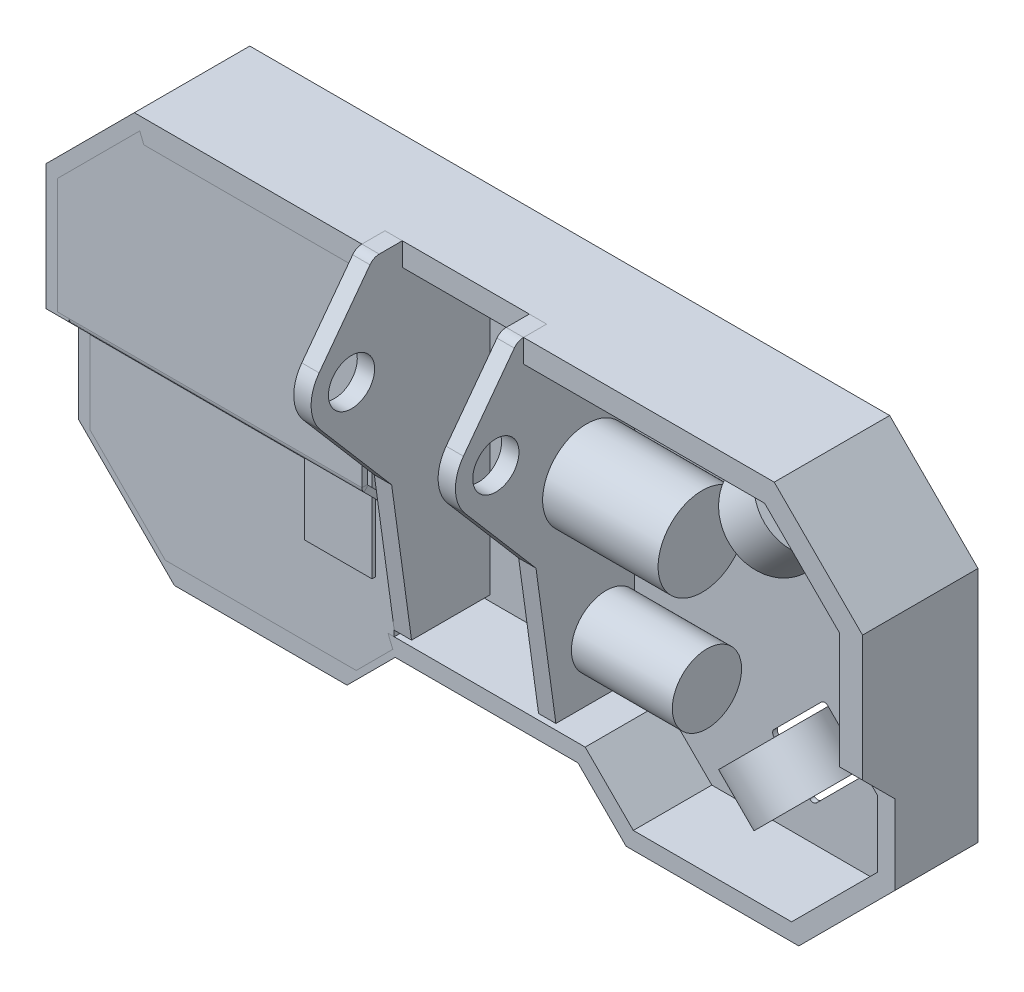
from build123d import *

# Parameters (mm, degrees)
TEMP_START              = 2.54
TEMP_BATTERY_OUTLINE_W  = 37
TEMP_BATTERY_OUTLINE_H  = 140
TEMP_BATTERY_DEPTH      = 45
TEMP_START_2            = 45.72
SIDEVIEW_SKETCH_R       = 19.05
TEMP_ARM_MOTOR_DEPTH    = 55.488642
TEMP_START_3            = 38.1
SKETCH9_3_R             = 24.264839711
TEMP_DISK_MOTOR_DEPTH   = 63.5
SKETCH2_R               = 25
TEMP_FRONT_WHEEL_DEPTH  = 27.5
SKETCH3_R               = 25
TEMP_BACK_WHEEL_DEPTH   = 27.5
BOSS_EXTRUDE14_DEPTH    = 63.5
CUT_EXTRUDE1_DEPTH      = 504.761656475
SKETCH13_W              = 88.9
SKETCH13_H              = 12.7
CUT_EXTRUDE2_DEPTH      = 12.7
CUT_EXTRUDE4_DEPTH      = 319.327625669
BILLET_BOTTOM_DEPTH     = 2.54
CUT_EXTRUDE3_DEPTH      = 321.186776216
CUT_EXTRUDE3_DEPTH_BACK = 321.186776216
L_START                 = -41.275
SKETCH8_R               = 12.7
L_UPRIGHT_DEPTH         = 9.525
R_START                 = 28.575
SKETCH8_5_R             = 12.7
R_UPRIGHT_DEPTH         = 9.525
FILLET1_R               = 2.54
BASE_FLANGE2_DEPTH      = 3.175
EDGE_FLANGE3_START      = -218.191187662
EDGE_FLANGE3_DEPTH      = 167.391187662
EDGE_FLANGE3_2_DEPTH    = 167.391187662
EDGE_FLANGE4_START      = -218.191187662
EDGE_FLANGE4_DEPTH      = 167.391187662
EDGE_FLANGE4_2_DEPTH    = 167.391187662
CUT_EXTRUDE5_DEPTH      = 319.652368089


# Read off the part's stored shape, not the designer's step: Temp Battery, Edge-Flange3, Edge-Flange4
# Sheet-metal steps are written as plain solids
with BuildPart() as part:
    # Temp Battery outline → Temp Battery (new body)
    with BuildSketch(Plane.XY.offset(TEMP_START)):
        with Locations((-79.704052147, -89.933835326)):
            Rectangle(TEMP_BATTERY_OUTLINE_W, TEMP_BATTERY_OUTLINE_H)
    extrude(amount=TEMP_BATTERY_DEPTH)


with BuildPart() as body_2:
    # Sideview Sketch → Temp Arm Motor (new body)
    with BuildSketch(Plane(origin=(0, 0, 0), x_dir=(0, 0, -1), z_dir=(1, 0, 0)).offset(TEMP_START_2)):
        with Locations((-25.749228435, -141.973618126)):
            Circle(SIDEVIEW_SKETCH_R)
    extrude(amount=TEMP_ARM_MOTOR_DEPTH)


with BuildPart() as body_3:
    # Sketch9<3> → Temp Disk Motor (new body)
    with BuildSketch(Plane(origin=(0, 0, 0), x_dir=(0, 0, -1), z_dir=(1, 0, 0)).offset(TEMP_START_3)):
        with Locations((-28.735809635, -70.080189422)):
            Circle(SKETCH9_3_R)
    extrude(amount=TEMP_DISK_MOTOR_DEPTH)


with BuildPart() as body_4:
    # Sketch2 → Temp Front Wheel (new body)
    with BuildSketch(Plane(origin=(-59.46385062, 59.46385062, 0), x_dir=(0, 0, 1), z_dir=(0.707106781186475, -0.7071067811866201, 0))):
        with Locations(Location((17.38, 127.05509626, 0), (0, 0, 270))):
            Circle(SKETCH2_R)
    extrude(amount=TEMP_FRONT_WHEEL_DEPTH)


with BuildPart() as body_5:
    # Sketch3 → Temp Back Wheel (new body)
    with BuildSketch(Plane(origin=(-161.889626162, -161.889626162, 0), x_dir=(0, 0, -1), z_dir=(0.7071067811866171, 0.7071067811864781, 0))):
        with Locations(Location((-17.38, -17.796824648, 0), (0, 0, 90))):
            Circle(SKETCH3_R)
    extrude(amount=TEMP_BACK_WHEEL_DEPTH)


with BuildPart() as body_6:
    # Mirror3: mirrored copy
    add(body_4.part.mirror(Plane(origin=(0, 0, 0), x_dir=(0, 0, 1), z_dir=(1, 0, 0))))


with BuildPart() as body_7:
    # Mirror3 2: mirrored copy
    add(body_5.part.mirror(Plane(origin=(0, 0, 0), x_dir=(0, 0, 1), z_dir=(1, 0, 0))))


with BuildPart() as body_8:
    # Sketch11 → Boss-Extrude14 (new body)
    with BuildSketch(Plane.XY):
        Polygon((-224.541187662, -166.408288725), (-171.704005038, -219.245471349), (-76.740625367, -219.245471349), (-50.275950129, -192.780796112), (50.275950129, -192.780796112), (76.740625367, -219.245471349), (171.704005038, -219.245471349), (224.541187662, -166.408288725), (224.541187662, -35.871479098), (175.969708564, 12.7), (-175.969708564, 12.7), (-224.541187662, -35.871479098), align=None)
        Polygon((-170.709196322, 0), (170.709196322, 0), (211.841187662, -41.13199134), (211.841187662, -161.147776483), (166.443492796, -206.545471349), (82.001137609, -206.545471349), (55.536462372, -180.080796112), (-55.536462372, -180.080796112), (-82.001137609, -206.545471349), (-166.443492796, -206.545471349), (-211.841187662, -161.147776483), (-211.841187662, -41.13199134), align=None, mode=Mode.SUBTRACT)
    extrude(amount=BOSS_EXTRUDE14_DEPTH)

    # Sketch12 → Cut-Extrude1 (cut, through all)
    with BuildSketch(Plane(origin=(-224.541187662, 0, 0), x_dir=(0, 0, -1), z_dir=(1, 0, 0))):
        Polygon((-63.5, -104.945471349), (-45.72, -122.725471349), (-45.72, -219.245471349), (-63.5, -219.245471349), align=None)
    extrude(amount=CUT_EXTRUDE1_DEPTH, mode=Mode.SUBTRACT)

    # Sketch13 → Cut-Extrude2 (cut)
    with BuildSketch(Plane(origin=(0, 12.7, 0), x_dir=(-1, 0, 0), z_dir=(0, -1, 0))):
        with Locations((6.35, -57.15)):
            Rectangle(SKETCH13_W, SKETCH13_H)
    extrude(amount=CUT_EXTRUDE2_DEPTH, mode=Mode.SUBTRACT)

    # Sketch31 → Cut-Extrude4 (cut, through all)
    with BuildSketch(Plane.XY.offset(45.72)):
        Polygon((-211.841187662, -122.725471349), (-215.016187662, -125.900471349), (-215.016187662, -162.462904543), (-167.758620856, -209.720471349), (-80.686009548, -209.720471349), (-54.221334311, -183.255796112), (0, -183.255796112), (54.221334311, -183.255796112), (80.686009548, -209.720471349), (167.758620856, -209.720471349), (215.016187662, -162.462904543), (215.016187662, -125.900471349), (211.841187662, -122.725471349), (211.841187662, -161.147776483), (166.443492796, -206.545471349), (82.001137609, -206.545471349), (55.536462372, -180.080796112), (0, -180.080796112), (-55.536462372, -180.080796112), (-82.001137609, -206.545471349), (-166.443492796, -206.545471349), (-211.841187662, -161.147776483), align=None)
    extrude(amount=-CUT_EXTRUDE4_DEPTH, mode=Mode.SUBTRACT)

    # Sketch14 → Billet Bottom (add)
    with BuildSketch(Plane(origin=(0, 0, 0), x_dir=(-1, 0, 0), z_dir=(0, 0, -1))):
        Polygon((224.541187662, -166.408288725), (224.541187662, -35.871479098), (175.969708564, 12.7), (-175.969708564, 12.7), (-224.541187662, -35.871479098), (-224.541187662, -166.408288725), (-171.704005038, -219.245471349), (-76.740625367, -219.245471349), (-50.275950129, -192.780796112), (50.275950129, -192.780796112), (76.740625367, -219.245471349), (171.704005038, -219.245471349), align=None)
    extrude(amount=-BILLET_BOTTOM_DEPTH)

    # Sketch15 → Cut-Extrude3 (cut, two sides: drawn at the far end of the back side and taken through both)
    with BuildSketch(Plane(origin=(0, 0, 0), x_dir=(-1, 0, 0), z_dir=(0, 0, -1)).offset(-CUT_EXTRUDE3_DEPTH_BACK)):
        Polygon((-136.439562886, -13.608632214), (-166.074408085, -43.243477413), (-142.72574217, -66.592143328), (-113.090896971, -36.957298129), align=None)
        Polygon((-166.074408085, -161.608073671), (-136.439562886, -191.24291887), (-113.090896971, -167.894252955), (-142.72574217, -138.259407756), align=None)
        Polygon((136.439562886, -13.608632214), (166.074408085, -43.243477413), (142.72574217, -66.592143328), (113.090896971, -36.957298129), align=None)
        Polygon((166.074408085, -161.608073671), (136.439562886, -191.24291887), (113.090896971, -167.894252955), (142.72574217, -138.259407756), align=None)
    extrude(amount=CUT_EXTRUDE3_DEPTH + CUT_EXTRUDE3_DEPTH_BACK, mode=Mode.SUBTRACT)

    # Fillet1
    fillet1_edges = [body_8.edges().sort_by_distance(p)[0] for p in [
        (113.090896971, -167.894252955, 1.27),
        (136.439562886, -191.24291887, 1.27),
        (166.074408085, -161.608073671, 1.27),
        (142.72574217, -138.259407756, 1.27),
        (-166.074408085, -43.243477413, 1.27),
        (-142.72574217, -66.592143328, 1.27),
        (-113.090896971, -36.957298129, 1.27),
        (-136.439562886, -13.608632214, 1.27),
        (-136.439562886, -191.24291887, 1.27),
        (-113.090896971, -167.894252955, 1.27),
        (-142.72574217, -138.259407756, 1.27),
        (-166.074408085, -161.608073671, 1.27),
        (142.72574217, -66.592143328, 1.27),
        (166.074408085, -43.243477413, 1.27),
        (136.439562886, -13.608632214, 1.27),
        (113.090896971, -36.957298129, 1.27),
    ]]
    fillet(fillet1_edges, radius=FILLET1_R)


with BuildPart() as body_9:
    # Sketch8 → L Upright (new body)
    with BuildSketch(Plane(origin=(0, 0, 0), x_dir=(0, 0, -1), z_dir=(1, 0, 0)).offset(L_START)):
        with BuildLine():
            Line((-50.8, 0), (-50.8, 12.7))
            Line((-50.8, 12.7), (-63.5, 12.7))
            ThreePointArc((-63.5, 12.7), (-66.347516998, 12.025750783), (-68.59032971, 10.146188014))
            Line((-68.59032971, 10.146188014), (-96.556153987, -27.35334195))
            ThreePointArc((-96.556153987, -27.35334195), (-100.952472396, -41.38612001), (-95.624400091, -55.092254445))
            Line((-95.624400091, -55.092254445), (-56.662044199, -100.611519823))
            Line((-56.662044199, -100.611519823), (-45.72, -180.080796112))
            Line((-45.72, -180.080796112), (-2.54, -180.080796112))
            Line((-2.54, -180.080796112), (-2.54, 0))
            Line((-2.54, 0), (-50.8, 0))
        make_face()
        with Locations((-78.74, -40.64)):
            Circle(SKETCH8_R, mode=Mode.SUBTRACT)
    extrude(amount=-L_UPRIGHT_DEPTH)


with BuildPart() as body_10:
    # Sketch8<5> → R Upright (new body)
    with BuildSketch(Plane(origin=(0, 0, 0), x_dir=(0, 0, -1), z_dir=(1, 0, 0)).offset(R_START)):
        with BuildLine():
            Line((-50.8, 0), (-50.8, 12.7))
            Line((-50.8, 12.7), (-63.5, 12.7))
            ThreePointArc((-63.5, 12.7), (-66.347516998, 12.025750783), (-68.59032971, 10.146188014))
            Line((-68.59032971, 10.146188014), (-96.556153987, -27.35334195))
            ThreePointArc((-96.556153987, -27.35334195), (-100.952472396, -41.38612001), (-95.624400091, -55.092254445))
            Line((-95.624400091, -55.092254445), (-56.662044199, -100.611519823))
            Line((-56.662044199, -100.611519823), (-45.72, -180.080796112))
            Line((-45.72, -180.080796112), (-2.54, -180.080796112))
            Line((-2.54, -180.080796112), (-2.54, 0))
            Line((-2.54, 0), (-50.8, 0))
        make_face()
        with Locations((-78.74, -40.64)):
            Circle(SKETCH8_5_R, mode=Mode.SUBTRACT)
    extrude(amount=R_UPRIGHT_DEPTH)


with BuildPart() as body_11:
    # Sketch17 → Base-Flange2 (new body)
    with BuildSketch(Plane.XY.offset(63.5)):
        Polygon((-218.191187662, -104.945471349), (-50.8, -104.945471349), (-50.8, 6.35), (-172.141337216, 6.35), (-218.191187662, -39.699850446), align=None)
    extrude(amount=-BASE_FLANGE2_DEPTH)

    # Edge-Flange3 outline → Edge-Flange3 (cut)
    with BuildSketch(Plane.YZ.offset(EDGE_FLANGE3_START)):
        with BuildLine():
            Line((-104.945471349, 63.5), (-104.945471349, 63.148658997))
            ThreePointArc((-104.945471349, 63.148658997), (-104.15418034, 63.411155789), (-103.325233579, 63.5))
            Line((-103.325233579, 63.5), (-104.945471349, 63.5))
        make_face()
    extrude(amount=EDGE_FLANGE3_DEPTH, mode=Mode.SUBTRACT)

    # Edge-Flange3 2 outline → Edge-Flange3 2 (add)
    with BuildSketch(Plane.YZ.offset(EDGE_FLANGE3_START)):
        with BuildLine():
            ThreePointArc((-104.945471349, 63.148658997), (-105.553985832, 62.80294164), (-106.091152464, 62.354318885))
            Line((-106.091152464, 62.354318885), (-122.725471349, 45.72))
            Line((-122.725471349, 45.72), (-120.480407319, 43.47493597))
            Line((-120.480407319, 43.47493597), (-103.846088434, 60.109254855))
            ThreePointArc((-103.846088434, 60.109254855), (-103.607118195, 60.268929664), (-103.325233579, 60.325))
            Line((-103.325233579, 60.325), (-104.945471349, 60.325))
            Line((-104.945471349, 60.325), (-104.945471349, 63.148658997))
        make_face()
    extrude(amount=EDGE_FLANGE3_2_DEPTH)

    # Edge-Flange4 outline → Edge-Flange4 (cut)
    with BuildSketch(Plane.YZ.offset(EDGE_FLANGE4_START)):
        with BuildLine():
            ThreePointArc((-120.264662174, 43.690681115), (-120.374724567, 43.584833845), (-120.488834353, 43.483363004))
            Line((-120.488834353, 43.483363004), (-120.480407319, 43.47493597))
            Line((-120.480407319, 43.47493597), (-120.264662174, 43.690681115))
        make_face()
    extrude(amount=EDGE_FLANGE4_DEPTH, mode=Mode.SUBTRACT)

    # Edge-Flange4 2 outline → Edge-Flange4 2 (add)
    with BuildSketch(Plane.YZ.offset(EDGE_FLANGE4_START)):
        with BuildLine():
            Line((-209.720471349, 42.545), (-123.030581059, 42.545))
            ThreePointArc((-123.030581059, 42.545), (-121.675866934, 42.787081749), (-120.488834353, 43.483363004))
            Line((-120.488834353, 43.483363004), (-122.725471349, 45.72))
            Line((-122.725471349, 45.72), (-122.509726204, 45.935745145))
            ThreePointArc((-122.509726204, 45.935745145), (-122.748696443, 45.776070336), (-123.030581059, 45.72))
            Line((-123.030581059, 45.72), (-209.720471349, 45.72))
            Line((-209.720471349, 45.72), (-209.720471349, 42.545))
        make_face()
    extrude(amount=EDGE_FLANGE4_2_DEPTH)

    # Sketch45 → Cut-Extrude5 (cut, through all)
    with BuildSketch(Plane.XY.offset(45.72)):
        Polygon((-71.705753427, -209.720471349), (-50.8, -188.814717922), (-50.8, -209.720471349), align=None)
        Polygon((-218.191187662, -168.268160664), (-176.738876977, -209.720471349), (-218.191187662, -209.720471349), align=None)
    extrude(amount=-CUT_EXTRUDE5_DEPTH, mode=Mode.SUBTRACT)


solid = Compound([part.part, body_2.part, body_3.part, body_4.part, body_5.part, body_6.part, body_7.part, body_8.part, body_9.part, body_10.part, body_11.part])
